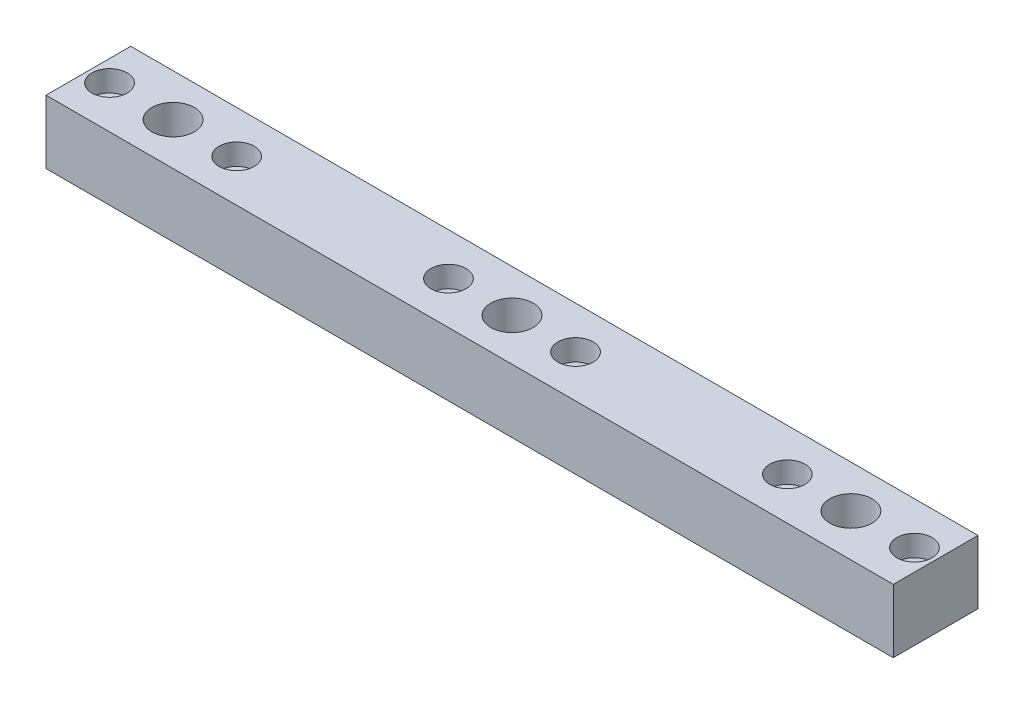
from build123d import *

# Parameters (mm, degrees)
SKETCH1_W           = 200
SKETCH1_H           = 20
SKETCH1_R           = 5
SKETCH1_R_2         = 2.5
BOSS_EXTRUDE1_DEPTH = 15
SKETCH2_R           = 4.15
CUT_EXTRUDE1_DEPTH  = 5


with BuildPart() as part:
    # Sketch1 → Boss-Extrude1 (new body)
    with BuildSketch(Plane(origin=(0, 0, 0), x_dir=(1, 0, 0), z_dir=(0, 1, 0))):
        with Locations((100, 10)):
            Rectangle(SKETCH1_W, SKETCH1_H)
        with Locations((20, 10)):
            Circle(SKETCH1_R, mode=Mode.SUBTRACT)
        with Locations((35, 10)):
            Circle(SKETCH1_R_2, mode=Mode.SUBTRACT)
        with Locations((5, 10)):
            Circle(SKETCH1_R_2, mode=Mode.SUBTRACT)
        with Locations((180, 10)):
            Circle(SKETCH1_R, mode=Mode.SUBTRACT)
        with Locations((195, 10)):
            Circle(SKETCH1_R_2, mode=Mode.SUBTRACT)
        with Locations((165, 10)):
            Circle(SKETCH1_R_2, mode=Mode.SUBTRACT)
        with Locations((100, 10)):
            Circle(SKETCH1_R, mode=Mode.SUBTRACT)
        with Locations((115, 10)):
            Circle(SKETCH1_R_2, mode=Mode.SUBTRACT)
        with Locations((85, 10)):
            Circle(SKETCH1_R_2, mode=Mode.SUBTRACT)
    extrude(amount=BOSS_EXTRUDE1_DEPTH)

    # Sketch2 → Cut-Extrude1 (cut)
    with BuildSketch(Plane(origin=(0, 15, 0), x_dir=(1, 0, 0), z_dir=(0, 1, 0))):
        with Locations((5, 10)):
            Circle(SKETCH2_R)
        with Locations((35, 10)):
            Circle(SKETCH2_R)
        with Locations((85, 10)):
            Circle(SKETCH2_R)
        with Locations((115, 10)):
            Circle(SKETCH2_R)
        with Locations((165, 10)):
            Circle(SKETCH2_R)
        with Locations((195, 10)):
            Circle(SKETCH2_R)
    extrude(amount=-CUT_EXTRUDE1_DEPTH, mode=Mode.SUBTRACT)


solid = part.part
